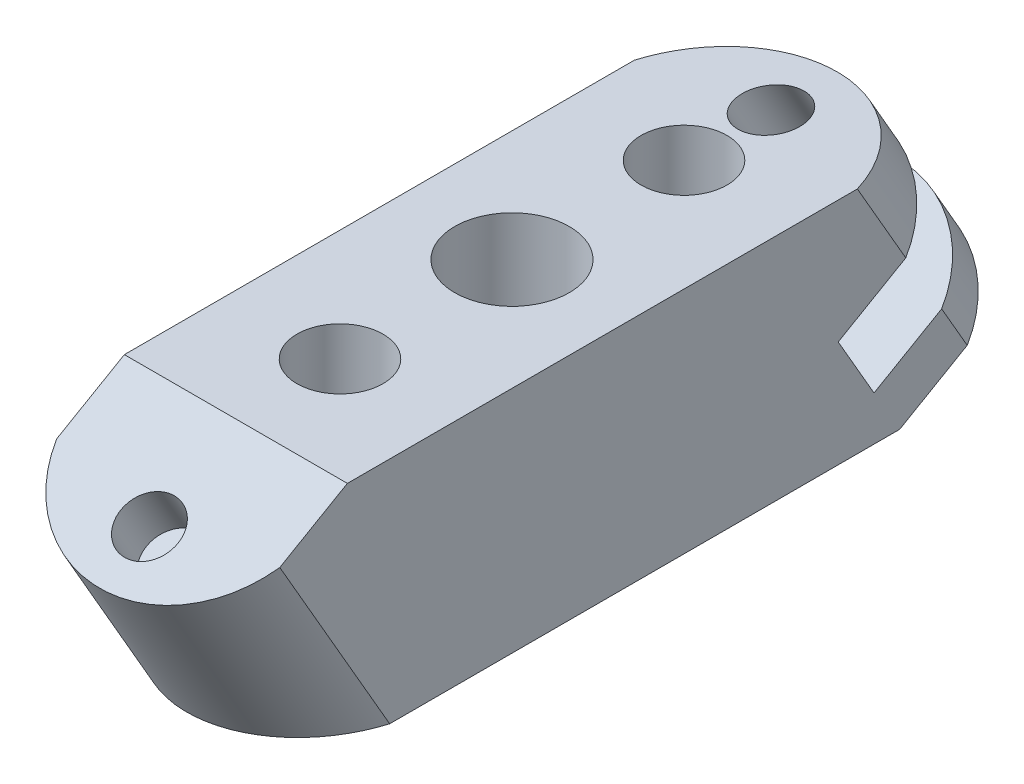
from build123d import *

# Parameters (mm, degrees)
SKETCH_1_W                      = 7.778385112
SKETCH_1_H                      = 31.92137072
EXTRUDE_1_DEPTH                 = 8
SKETCH_2_R                      = 1.5
SKETCH_2_R_2                    = 2
CUT_EXTRUDE_1_DEPTH             = 8
SKETCH_3_W                      = 7.778385112
SKETCH_3_H                      = 11.681320089
CUT_EXTRUDE_2_DEPTH             = 7
CUT_EXTRUDE_3_DEPTH             = 7.778385113
CUT_EXTRUDE_6_REACH             = 24.375
CUT_EXTRUDE_7_DEPTH             = 1.25
CUT_EXTRUDE_7_DEPTH_BACK        = 1.25
CUT_EXTRUDE_8_REACH             = 24.375
SKETCH_8_R                      = 1
PATTERN_CIRCULAR_5_COUNT        = 2
CUT_EXTRUDE_9_DEPTH             = 23.991982407
CUT_EXTRUDE_9_DEPTH_BACK        = 23.991982407
PATTERN_START                   = 3.938890695
PATTERN_CIRCULAR_14_OUTLINE_R   = 1
PATTERN_CIRCULAR_14_DEPTH       = 3.518451758
PATTERN_START_2                 = 9.957342453
PATTERN_CIRCULAR_14_2_OUTLINE_R = 1
PATTERN_CIRCULAR_14_2_DEPTH     = 1.78640085


# Read off the part's stored shape, not the designer's step: 阵列(圆周)14
with BuildPart() as part:
    # 草图1 → 凸台-拉伸1 (new body)
    with BuildSketch(Plane(origin=(0, 0, 0), x_dir=(1, 0, 0), z_dir=(0, 1, 0))):
        Rectangle(SKETCH_1_W, SKETCH_1_H)
    extrude(amount=EXTRUDE_1_DEPTH)

    # 草图2 → 切除-拉伸1 (cut)
    with BuildSketch(Plane(origin=(0, 8, 0), x_dir=(1, 0, 0), z_dir=(0, 1, 0))):
        with Locations(Location((0, 6, 0), (0, 0, 270))):
            Circle(SKETCH_2_R)
        with Locations(Location((0, -6, 0), (0, 0, 270))):
            Circle(SKETCH_2_R)
        with Locations(Location((0, 0, 0), (0, 0, 270))):
            Circle(SKETCH_2_R_2)
    extrude(amount=-CUT_EXTRUDE_1_DEPTH, mode=Mode.SUBTRACT)

    # 草图3 → 切除-拉伸2 (cut)
    with BuildSketch(Plane(origin=(0, 6.911179492, -11.97051402), x_dir=(-1, 0, 0), z_dir=(0, -0.499999999999998, 0.8660254037844398))):
        with Locations((0, 2.139682636)):
            Rectangle(SKETCH_3_W, SKETCH_3_H)
    cut_extrude_2 = extrude(amount=-CUT_EXTRUDE_2_DEPTH, mode=Mode.SUBTRACT)

    # 草图4 → 切除-拉伸3 (cut)
    with BuildSketch(Plane.ZY.offset(3.889192556)):
        Polygon((-14.378284056, 2.740799456), (-9.631080146, 0), (-15.96068536, 0), align=None)
    cut_extrude_3 = extrude(amount=-CUT_EXTRUDE_3_DEPTH, mode=Mode.SUBTRACT)

    # 切除-拉伸6: up to this plane
    cut_extrude_6_end = Plane(origin=(0, 8, 0), z_dir=(0, 1, 0))
    # 草图6 → 切除-拉伸6 (cut, up to the surface)
    with BuildSketch(Plane(origin=(0, -4.170380036, -2.407770036), x_dir=(1, 0, 0), z_dir=(0, -0.8660254037844396, -0.4999999999999982)), mode=Mode.PRIVATE) as cut_extrude_6_sk1:
        with BuildLine():
            Line((-3.889192556, -13.822358983), (5e-09, -13.822358983))
            ThreePointArc((5e-09, -13.822358983), (-2.384323859, -13.062439969), (-3.889192556, -11.062978192))
            Line((-3.889192556, -11.062978192), (-3.889192556, -13.822358983))
        make_face()
    cut_extrude_6_tool1 = split(extrude(cut_extrude_6_sk1.sketch, amount=-CUT_EXTRUDE_6_REACH, mode=Mode.PRIVATE), bisect_by=cut_extrude_6_end, keep=Keep.BOTH, mode=Mode.PRIVATE)
    add(cut_extrude_6_tool1.solids().sort_by_distance((-2.992661, 2.37004, -13.736111))[0], mode=Mode.SUBTRACT)
    # 草图6 → 切除-拉伸6 (cut, up to the surface)
    with BuildSketch(Plane(origin=(0, -4.170380036, -2.407770036), x_dir=(1, 0, 0), z_dir=(0, -0.8660254037844396, -0.4999999999999982)), mode=Mode.PRIVATE) as cut_extrude_6_sk2:
        with BuildLine():
            Line((3.889192556, -13.822358983), (3.889192556, -11.062978192))
            ThreePointArc((3.889192556, -11.062978192), (2.384323863, -13.062439966), (5e-09, -13.822358983))
            Line((5e-09, -13.822358983), (3.889192556, -13.822358983))
        make_face()
    cut_extrude_6_tool2 = split(extrude(cut_extrude_6_sk2.sketch, amount=-CUT_EXTRUDE_6_REACH, mode=Mode.PRIVATE), bisect_by=cut_extrude_6_end, keep=Keep.BOTH, mode=Mode.PRIVATE)
    add(cut_extrude_6_tool2.solids().sort_by_distance((2.992661, 2.37004, -13.736111))[0], mode=Mode.SUBTRACT)

    # 草图7 → 切除-拉伸7 (cut, two sides: drawn at the far end of the back side and taken through both)
    with BuildSketch(Plane(origin=(0, -1.540779764, -0.889569611), x_dir=(-1, 0, 0), z_dir=(0, -0.8660254037844396, -0.4999999999999983)).offset(-CUT_EXTRUDE_7_DEPTH_BACK)):
        with BuildLine():
            Line((-3.889192556, 11.062978192), (-3.889192556, 8.340760072))
            Line((-3.889192556, 8.340760072), (3.889192556, 8.340760072))
            Line((3.889192556, 8.340760072), (3.889192556, 11.062978192))
            ThreePointArc((3.889192556, 11.062978192), (0, 13.822358983), (-3.889192556, 11.062978192))
        make_face()
    extrude(amount=CUT_EXTRUDE_7_DEPTH + CUT_EXTRUDE_7_DEPTH_BACK, mode=Mode.SUBTRACT)

    # 切除-拉伸8: up to this plane
    cut_extrude_8_end = Plane(origin=(0, 8, 0), z_dir=(0, 1, 0))
    # 草图8 → 切除-拉伸8 (cut, up to the surface)
    with BuildSketch(Plane(origin=(0, -4.170380036, -2.407770036), x_dir=(1, 0, 0), z_dir=(0, -0.8660254037844396, -0.4999999999999982)), mode=Mode.PRIVATE) as cut_extrude_8_sk1:
        with Locations(Location((0, -11.822358983, 0), (0, 0, 270))):
            Circle(SKETCH_8_R)
    cut_extrude_8_tool1 = split(extrude(cut_extrude_8_sk1.sketch, amount=-CUT_EXTRUDE_8_REACH, mode=Mode.PRIVATE), bisect_by=cut_extrude_8_end, keep=Keep.BOTH, mode=Mode.PRIVATE)
    add(cut_extrude_8_tool1.solids().sort_by_distance((0, 1.740799, -12.646233))[0], mode=Mode.SUBTRACT)

    # 阵列(圆周)5: 切除-拉伸2, 切除-拉伸3 ×2 about axis
    pattern_circular_5_axis = Axis((-4.278111812, 4, 0), (1, 0, 0))
    add([cut_extrude_2.rotate(pattern_circular_5_axis, i * 360 / PATTERN_CIRCULAR_5_COUNT) for i in range(1, PATTERN_CIRCULAR_5_COUNT)], mode=Mode.SUBTRACT)
    add([cut_extrude_3.rotate(pattern_circular_5_axis, i * 360 / PATTERN_CIRCULAR_5_COUNT) for i in range(1, PATTERN_CIRCULAR_5_COUNT)], mode=Mode.SUBTRACT)

    # 草图10 → 切除-拉伸9 (cut, two sides: drawn at the far end of the back side and taken through both)
    with BuildSketch(Plane(origin=(0, 10.170380036, 5.871871652), x_dir=(1, 0, 0), z_dir=(0, 0.8660254037844388, 0.49999999999999994)).offset(-CUT_EXTRUDE_9_DEPTH_BACK)):
        with BuildLine():
            ThreePointArc((0, -9.822358983), (-2.384323861, -9.062439968), (-3.889192556, -7.062978192))
            Line((-3.889192556, -7.062978192), (-3.889192556, -9.822358983))
            Line((-3.889192556, -9.822358983), (0, -9.822358983))
        make_face()
        with BuildLine():
            ThreePointArc((3.889192556, -7.062978192), (2.384323861, -9.062439968), (0, -9.822358983))
            Line((0, -9.822358983), (3.889192556, -9.822358983))
            Line((3.889192556, -9.822358983), (3.889192556, -7.062978192))
        make_face()
    extrude(amount=CUT_EXTRUDE_9_DEPTH + CUT_EXTRUDE_9_DEPTH_BACK, mode=Mode.SUBTRACT)

    # 阵列(圆周)14 outline → 阵列(圆周)14 (cut)
    with BuildSketch(Plane(origin=(0, 0, 0), x_dir=(1, 0, 0), z_dir=(0, 0.8660254037844399, 0.49999999999999795)).offset(PATTERN_START)):
        with Locations((0, -7.822358983)):
            Circle(PATTERN_CIRCULAR_14_OUTLINE_R)
    extrude(amount=PATTERN_CIRCULAR_14_DEPTH, mode=Mode.SUBTRACT)

    # Pattern Circular 14 2 outline → Pattern Circular 14 2 (cut)
    with BuildSketch(Plane(origin=(0, 0, 0), x_dir=(1, 0, 0), z_dir=(0, 0.8660254037844399, 0.49999999999999795)).offset(PATTERN_START_2)):
        with Locations((0, -7.822358983)):
            Circle(PATTERN_CIRCULAR_14_2_OUTLINE_R)
    extrude(amount=PATTERN_CIRCULAR_14_2_DEPTH, mode=Mode.SUBTRACT)


solid = part.part
